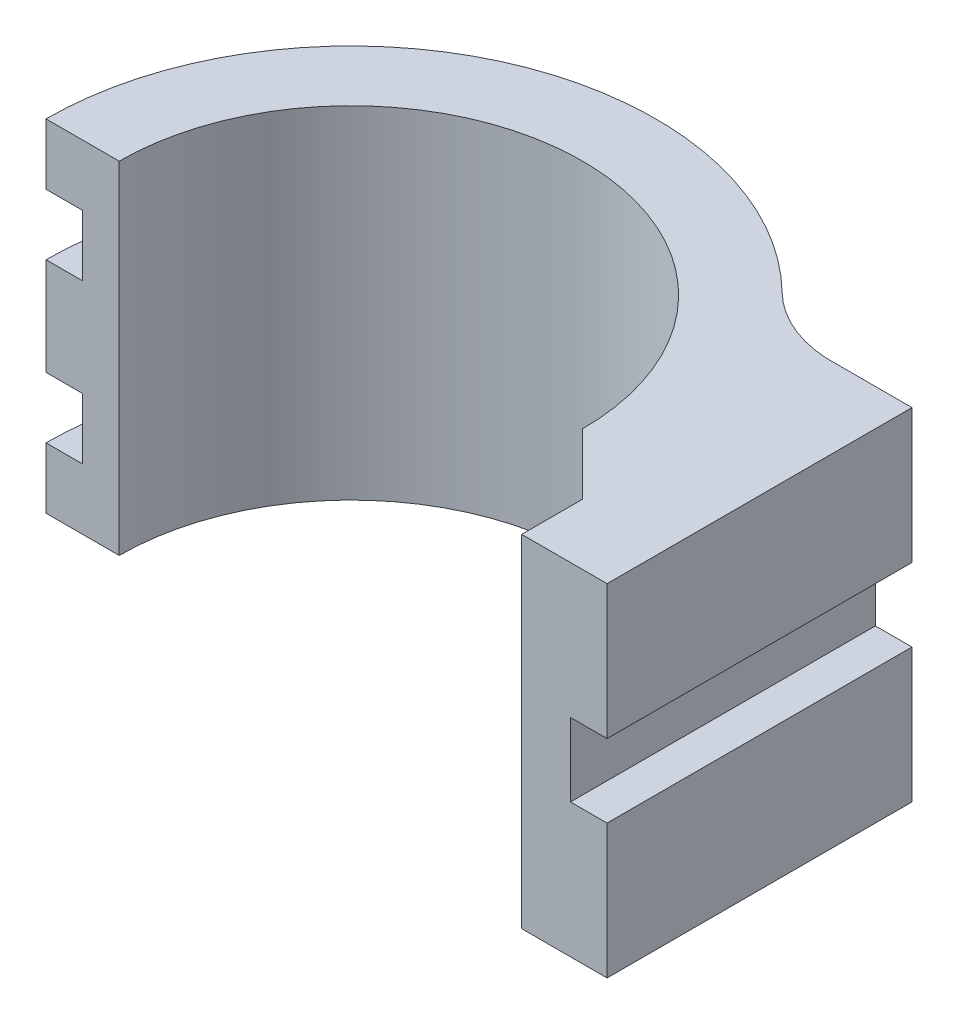
from build123d import *

# Parameters (mm, degrees)
REVOLUCI_N1_ANGLE       = 180
CROQUIS2_R              = 19
CORTAR_EXTRUIR1_DEPTH   = 29
SALIENTE_EXTRUIR1_DEPTH = 15
CROQUIS4_W              = 7
CROQUIS4_H              = 28
SALIENTE_EXTRUIR2_DEPTH = 10
CHAFL_N1_SIZE           = 5
REDONDEO1_R             = 10
CORTAR_EXTRUIR2_DEPTH   = 40


with BuildPart() as part:
    # Croquis1 → Revolución1 (revolve)
    with BuildSketch(Plane.XY):
        Polygon((0, 0), (0, 28), (25, 28), (25, 23), (22, 23), (22, 18), (25, 18), (25, 10), (22, 10), (22, 5), (25, 5), (25, 0), align=None)
    revolve(axis=Axis((0, 0, 0), (0, 1, 0)), revolution_arc=REVOLUCI_N1_ANGLE)

    # Croquis2 → Cortar-Extruir1 (cut)
    with BuildSketch(Plane(origin=(0, 28, 0), x_dir=(1, 0, 0), z_dir=(0, 1, 0))):
        Circle(CROQUIS2_R)
    extrude(amount=-CORTAR_EXTRUIR1_DEPTH, mode=Mode.SUBTRACT)

    # Croquis3 → Saliente-Extruir1 (add)
    with BuildSketch(Plane.XY):
        Polygon((25, 28), (24, 28), (24, 0), (31, 0), (31, 28), align=None)
    extrude(amount=-SALIENTE_EXTRUIR1_DEPTH)

    # Croquis4 → Saliente-Extruir2 (add)
    with BuildSketch(Plane.XY):
        with Locations((27.5, 14)):
            Rectangle(CROQUIS4_W, CROQUIS4_H)
    extrude(amount=SALIENTE_EXTRUIR2_DEPTH)

    # Chaflán1
    # the kernel refuses this chamfer: 5 mm, written as the material it adds along each edge
    with BuildSketch(Plane(origin=(24, 10.14158506, 0), x_dir=(0.027495876610586317, 0, 0.9996219169112968), z_dir=(0, 1, 0))) as chafl_n1_piece_1_section:
        Polygon((CHAFL_N1_SIZE * 0.999621916911, -CHAFL_N1_SIZE * 0.0274958766106), (-CHAFL_N1_SIZE * 0.0274958766106, -CHAFL_N1_SIZE * 0.999621916911), (0, 0), align=None)
    chafl_n1_piece_1 = extrude(amount=30.71682988, mode=Mode.PRIVATE)
    chafl_n1_piece_1 = split(chafl_n1_piece_1, bisect_by=Plane(origin=(23.057401275, 18, 2.044863286), z_dir=(0, -1, 0)), keep=Keep.TOP, mode=Mode.PRIVATE)
    add(chafl_n1_piece_1)
    with BuildSketch(Plane(origin=(24, 10.14158506, 0), x_dir=(0.027495876610586317, 0, 0.9996219169112968), z_dir=(0, 1, 0))) as chafl_n1_piece_2_section:
        Polygon((CHAFL_N1_SIZE * 0.999621916911, -CHAFL_N1_SIZE * 0.0274958766106), (-CHAFL_N1_SIZE * 0.0274958766106, -CHAFL_N1_SIZE * 0.999621916911), (0, 0), align=None)
    chafl_n1_piece_2 = extrude(amount=17.85841494, mode=Mode.PRIVATE)
    chafl_n1_piece_2 = chafl_n1_piece_2 & Plane(origin=(0, 20.5, 0), x_dir=(1, 0, 0), z_dir=(0, -1, 0)) * Cylinder(22, 56, mode=Mode.PRIVATE)
    add(chafl_n1_piece_2)
    with BuildSketch(Plane(origin=(24, 23, 0), x_dir=(0.027495876610586317, 0, 0.9996219169112968), z_dir=(0, 1, 0)), Plane(origin=(24, 0, 0), x_dir=(0.027495876610586317, 0, 0.9996219169112968), z_dir=(0, 1, 0))) as chafl_n1_piece_3:
        Polygon((CHAFL_N1_SIZE * 0.999621916911, -CHAFL_N1_SIZE * 0.0274958766106), (-CHAFL_N1_SIZE * 0.0274958766106, -CHAFL_N1_SIZE * 0.999621916911), (0, 0), align=None)
    extrude(amount=5)
    with BuildSketch(Plane(origin=(24, -2.85841494, 0), x_dir=(0.027495876610586317, 0, 0.9996219169112968), z_dir=(0, 1, 0))) as chafl_n1_piece_4_section:
        Polygon((CHAFL_N1_SIZE * 0.999621916911, -CHAFL_N1_SIZE * 0.0274958766106), (-CHAFL_N1_SIZE * 0.0274958766106, -CHAFL_N1_SIZE * 0.999621916911), (0, 0), align=None)
    chafl_n1_piece_4 = extrude(amount=33.71682988, mode=Mode.PRIVATE)
    chafl_n1_piece_4 = split(chafl_n1_piece_4, bisect_by=Plane(origin=(23.057401275, 0, 2.044863286), z_dir=(0, 1, 0)), keep=Keep.TOP, mode=Mode.PRIVATE)
    chafl_n1_piece_4 = split(chafl_n1_piece_4, bisect_by=Plane(origin=(23.057401275, 5, 2.044863286), z_dir=(0, -1, 0)), keep=Keep.TOP, mode=Mode.PRIVATE)
    add(chafl_n1_piece_4)
    with BuildSketch(Plane(origin=(24, -2.85841494, 0), x_dir=(0.027495876610586317, 0, 0.9996219169112968), z_dir=(0, 1, 0))) as chafl_n1_piece_5_section:
        Polygon((CHAFL_N1_SIZE * 0.999621916911, -CHAFL_N1_SIZE * 0.0274958766106), (-CHAFL_N1_SIZE * 0.0274958766106, -CHAFL_N1_SIZE * 0.999621916911), (0, 0), align=None)
    chafl_n1_piece_5 = extrude(amount=33.71682988, mode=Mode.PRIVATE)
    chafl_n1_piece_5 = split(chafl_n1_piece_5, bisect_by=Plane(origin=(20.959134142, 28, 0.94889219), z_dir=(0, -1, 0)), keep=Keep.TOP, mode=Mode.PRIVATE)
    chafl_n1_piece_5 = split(chafl_n1_piece_5, bisect_by=Plane(origin=(20.959134142, 5, 0.94889219), z_dir=(0, 1, 0)), keep=Keep.TOP, mode=Mode.PRIVATE)
    chafl_n1_piece_5 = chafl_n1_piece_5 & Plane(origin=(0, 7.5, 0), x_dir=(1, 0, 0), z_dir=(0, -1, 0)) * Cylinder(22, 88, mode=Mode.PRIVATE)
    add(chafl_n1_piece_5)
    with BuildSketch(Plane(origin=(24, 10, 0), x_dir=(0.027495876610586317, 0, 0.9996219169112968), z_dir=(0, 1, 0))) as chafl_n1_piece_6:
        Polygon((CHAFL_N1_SIZE * 0.999621916911, -CHAFL_N1_SIZE * 0.0274958766106), (-CHAFL_N1_SIZE * 0.0274958766106, -CHAFL_N1_SIZE * 0.999621916911), (0, 0), align=None)
    extrude(amount=8)
    with BuildSketch(Plane(origin=(24, -2.85841494, 0), x_dir=(0.027495876610586317, 0, 0.9996219169112968), z_dir=(0, 1, 0))) as chafl_n1_piece_7_section:
        Polygon((CHAFL_N1_SIZE * 0.999621916911, -CHAFL_N1_SIZE * 0.0274958766106), (-CHAFL_N1_SIZE * 0.0274958766106, -CHAFL_N1_SIZE * 0.999621916911), (0, 0), align=None)
    chafl_n1_piece_7 = extrude(amount=33.71682988, mode=Mode.PRIVATE)
    chafl_n1_piece_7 = split(chafl_n1_piece_7, bisect_by=Plane(origin=(23.057401275, 28, 2.044863286), z_dir=(0, -1, 0)), keep=Keep.TOP, mode=Mode.PRIVATE)
    chafl_n1_piece_7 = split(chafl_n1_piece_7, bisect_by=Plane(origin=(23.057401275, 23, 2.044863286), z_dir=(0, 1, 0)), keep=Keep.TOP, mode=Mode.PRIVATE)
    add(chafl_n1_piece_7)
    with BuildSketch(Plane(origin=(24, -12.85841494, 0), x_dir=(0.027495876610586317, 0, 0.9996219169112968), z_dir=(0, 1, 0))) as chafl_n1_piece_8_section:
        Polygon((CHAFL_N1_SIZE * 0.999621916911, -CHAFL_N1_SIZE * 0.0274958766106), (-CHAFL_N1_SIZE * 0.0274958766106, -CHAFL_N1_SIZE * 0.999621916911), (0, 0), align=None)
    chafl_n1_piece_8 = extrude(amount=30.71682988, mode=Mode.PRIVATE)
    chafl_n1_piece_8 = split(chafl_n1_piece_8, bisect_by=Plane(origin=(20.959134142, 5, 0.94889219), z_dir=(0, 1, 0)), keep=Keep.TOP, mode=Mode.PRIVATE)
    chafl_n1_piece_8 = chafl_n1_piece_8 & Plane(origin=(0, 7.5, 0), x_dir=(1, 0, 0), z_dir=(0, -1, 0)) * Cylinder(22, 82, mode=Mode.PRIVATE)
    add(chafl_n1_piece_8)
    with BuildSketch(Plane(origin=(24, -12.85841494, 0), x_dir=(0.027495876610586317, 0, 0.9996219169112968), z_dir=(0, 1, 0))) as chafl_n1_piece_9_section:
        Polygon((CHAFL_N1_SIZE * 0.999621916911, -CHAFL_N1_SIZE * 0.0274958766106), (-CHAFL_N1_SIZE * 0.0274958766106, -CHAFL_N1_SIZE * 0.999621916911), (0, 0), align=None)
    chafl_n1_piece_9 = extrude(amount=30.71682988, mode=Mode.PRIVATE)
    chafl_n1_piece_9 = split(chafl_n1_piece_9, bisect_by=Plane(origin=(23.057401275, 10, 2.044863286), z_dir=(0, 1, 0)), keep=Keep.TOP, mode=Mode.PRIVATE)
    add(chafl_n1_piece_9)

    # Redondeo1
    # the kernel refuses this fillet: 10 mm, written as the material it adds along each edge
    with BuildSketch(Plane(origin=(24, 28, -7), x_dir=(-0.5136512800645924, 0, -0.8579990457384005), z_dir=(0, -1, 0)), Plane(origin=(24, 5, -7), x_dir=(-0.5136512800645924, 0, -0.8579990457384005), z_dir=(0, -1, 0))) as redondeo1_piece_1:
        with BuildLine():
            CenterArc((15.171929763, 9.675014423), REDONDEO1_R, 213.819639199, 41.5332183)
            Line((6.863992366, 4.109210241), (0, 0))
            ThreePointArc((0, 0), (6.321637401, 0.812463942), (12.643274803, 0))
        make_face()
    extrude(amount=5)
    with BuildSketch(Plane(origin=(24, 59.608187007, -7), x_dir=(-0.5136512800645924, 0, -0.8579990457384005), z_dir=(0, -1, 0))) as redondeo1_piece_2_section:
        with BuildLine():
            CenterArc((15.171929763, 9.675014423), REDONDEO1_R, 213.819639199, 41.5332183)
            Line((6.863992366, 4.109210241), (0, 0))
            ThreePointArc((0, 0), (6.321637401, 0.812463942), (12.643274803, 0))
        make_face()
    redondeo1_piece_2 = extrude(amount=68.216374014, mode=Mode.PRIVATE)
    redondeo1_piece_2 = split(redondeo1_piece_2, bisect_by=Plane(origin=(20.483934171, 18, -15.810663128), z_dir=(0, -1, 0)), keep=Keep.TOP, mode=Mode.PRIVATE)
    redondeo1_piece_2 = split(redondeo1_piece_2, bisect_by=Plane(origin=(20.483934171, 10, -15.810663128), z_dir=(0, 1, 0)), keep=Keep.TOP, mode=Mode.PRIVATE)
    add(redondeo1_piece_2)
    with BuildSketch(Plane(origin=(24, 59.608187007, -7), x_dir=(-0.5136512800645924, 0, -0.8579990457384005), z_dir=(0, -1, 0))) as redondeo1_piece_3_section:
        with BuildLine():
            CenterArc((15.171929763, 9.675014423), REDONDEO1_R, 213.819639199, 41.5332183)
            Line((6.863992366, 4.109210241), (0, 0))
            ThreePointArc((0, 0), (6.321637401, 0.812463942), (12.643274803, 0))
        make_face()
    redondeo1_piece_3 = extrude(amount=68.216374014, mode=Mode.PRIVATE)
    redondeo1_piece_3 = split(redondeo1_piece_3, bisect_by=Plane(origin=(20.483934171, 5, -15.810663128), z_dir=(0, -1, 0)), keep=Keep.TOP, mode=Mode.PRIVATE)
    redondeo1_piece_3 = split(redondeo1_piece_3, bisect_by=Plane(origin=(20.483934171, 0, -15.810663128), z_dir=(0, 1, 0)), keep=Keep.TOP, mode=Mode.PRIVATE)
    add(redondeo1_piece_3)
    with BuildSketch(Plane(origin=(24, 49.608187007, -7), x_dir=(-0.5136512800645924, 0, -0.8579990457384005), z_dir=(0, -1, 0))) as redondeo1_piece_4_section:
        with BuildLine():
            CenterArc((15.171929763, 9.675014423), REDONDEO1_R, 213.819639199, 41.5332183)
            Line((6.863992366, 4.109210241), (0, 0))
            ThreePointArc((0, 0), (6.321637401, 0.812463942), (12.643274803, 0))
        make_face()
    redondeo1_piece_4 = extrude(amount=71.216374014, mode=Mode.PRIVATE)
    redondeo1_piece_4 = split(redondeo1_piece_4, bisect_by=Plane(origin=(20.483934171, 28, -15.810663128), z_dir=(0, -1, 0)), keep=Keep.TOP, mode=Mode.PRIVATE)
    redondeo1_piece_4 = split(redondeo1_piece_4, bisect_by=Plane(origin=(20.483934171, 23, -15.810663128), z_dir=(0, 1, 0)), keep=Keep.TOP, mode=Mode.PRIVATE)
    add(redondeo1_piece_4)
    with BuildSketch(Plane(origin=(24, 18, -7), x_dir=(-0.5136512800645924, 0, -0.8579990457384005), z_dir=(0, -1, 0))) as redondeo1_piece_5:
        with BuildLine():
            CenterArc((15.171929763, 9.675014423), REDONDEO1_R, 213.819639199, 41.5332183)
            Line((6.863992366, 4.109210241), (0, 0))
            ThreePointArc((0, 0), (6.321637401, 0.812463942), (12.643274803, 0))
        make_face()
    extrude(amount=8)
    with BuildSketch(Plane(origin=(24, 49.608187007, -7), x_dir=(-0.5136512800645924, 0, -0.8579990457384005), z_dir=(0, -1, 0))) as redondeo1_piece_6_section:
        with BuildLine():
            CenterArc((15.171929763, 9.675014423), REDONDEO1_R, 213.819639199, 41.5332183)
            Line((6.863992366, 4.109210241), (0, 0))
            ThreePointArc((0, 0), (6.321637401, 0.812463942), (12.643274803, 0))
        make_face()
    redondeo1_piece_6 = extrude(amount=71.216374014, mode=Mode.PRIVATE)
    redondeo1_piece_6 = split(redondeo1_piece_6, bisect_by=Plane(origin=(20.483934171, 5, -15.810663128), z_dir=(0, -1, 0)), keep=Keep.TOP, mode=Mode.PRIVATE)
    redondeo1_piece_6 = split(redondeo1_piece_6, bisect_by=Plane(origin=(20.483934171, 0, -15.810663128), z_dir=(0, 1, 0)), keep=Keep.TOP, mode=Mode.PRIVATE)
    add(redondeo1_piece_6)
    with BuildSketch(Plane(origin=(24, 36.608187007, -7), x_dir=(-0.5136512800645924, 0, -0.8579990457384005), z_dir=(0, -1, 0))) as redondeo1_piece_7_section:
        with BuildLine():
            CenterArc((15.171929763, 9.675014423), REDONDEO1_R, 213.819639199, 41.5332183)
            Line((6.863992366, 4.109210241), (0, 0))
            ThreePointArc((0, 0), (6.321637401, 0.812463942), (12.643274803, 0))
        make_face()
    redondeo1_piece_7 = extrude(amount=68.216374014, mode=Mode.PRIVATE)
    redondeo1_piece_7 = split(redondeo1_piece_7, bisect_by=Plane(origin=(20.483934171, 28, -15.810663128), z_dir=(0, -1, 0)), keep=Keep.TOP, mode=Mode.PRIVATE)
    redondeo1_piece_7 = split(redondeo1_piece_7, bisect_by=Plane(origin=(20.483934171, 23, -15.810663128), z_dir=(0, 1, 0)), keep=Keep.TOP, mode=Mode.PRIVATE)
    add(redondeo1_piece_7)
    with BuildSketch(Plane(origin=(24, 36.608187007, -7), x_dir=(-0.5136512800645924, 0, -0.8579990457384005), z_dir=(0, -1, 0))) as redondeo1_piece_8_section:
        with BuildLine():
            CenterArc((15.171929763, 9.675014423), REDONDEO1_R, 213.819639199, 41.5332183)
            Line((6.863992366, 4.109210241), (0, 0))
            ThreePointArc((0, 0), (6.321637401, 0.812463942), (12.643274803, 0))
        make_face()
    redondeo1_piece_8 = extrude(amount=68.216374014, mode=Mode.PRIVATE)
    redondeo1_piece_8 = split(redondeo1_piece_8, bisect_by=Plane(origin=(20.483934171, 18, -15.810663128), z_dir=(0, -1, 0)), keep=Keep.TOP, mode=Mode.PRIVATE)
    redondeo1_piece_8 = split(redondeo1_piece_8, bisect_by=Plane(origin=(20.483934171, 10, -15.810663128), z_dir=(0, 1, 0)), keep=Keep.TOP, mode=Mode.PRIVATE)
    add(redondeo1_piece_8)

    # Croquis5 → Cortar-Extruir2 (cut)
    with BuildSketch(Plane(origin=(0, 0, -15), x_dir=(-1, 0, 0), z_dir=(0, 0, -1))):
        Polygon((-31, 14), (-31, 11), (-28, 11), (-28, 17), (-31, 17), align=None)
    extrude(amount=-CORTAR_EXTRUIR2_DEPTH, mode=Mode.SUBTRACT)


solid = part.part
